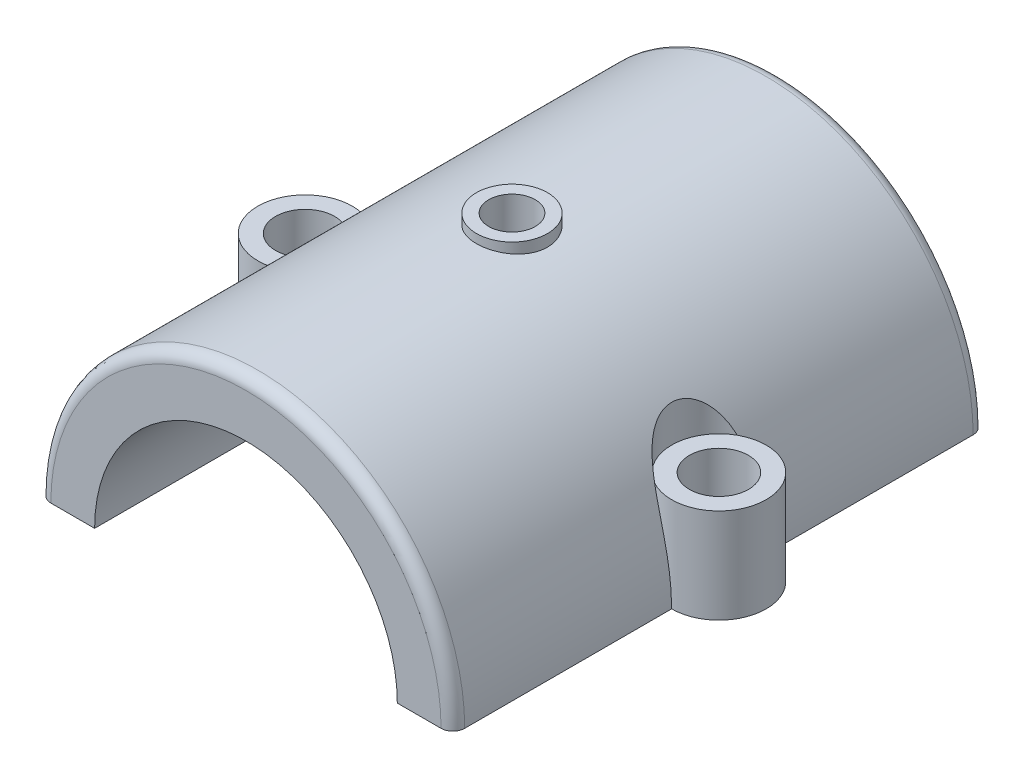
from build123d import *

# Parameters (mm, degrees)
BOSS_EXTRUDE1_DEPTH     = 114.3
SKETCH3_R               = 10.16
BOSS_EXTRUDE2_DEPTH     = 20.32
SKETCH5_R               = 10.16
CUT_EXTRUDE1_DEPTH      = 12.7
FILLET2_R               = 2.54
SKETCH6_R               = 6.35
CUT_EXTRUDE2_DEPTH      = 129.953476168
BOSS_EXTRUDE3_START     = 43.791955851
BOSS_EXTRUDE3_DEPTH     = 3.198044249
BOSS_EXTRUDE3_START_2   = 49
BOSS_EXTRUDE3_2_DEPTH   = 17
CUT_EXTRUDE3_DEPTH      = 136.11033375
CUT_EXTRUDE3_DEPTH_BACK = 136.11033375
SKETCH8_W               = 15.239999981
SKETCH8_H               = 4.021184516
CUT_EXTRUDE4_DEPTH      = 135.882901337
CUT_EXTRUDE4_DEPTH_BACK = 135.882901337
SKETCH10_R              = 3.175
SKETCH11_R              = 5
CUT_EXTRUDE5_DEPTH      = 30


with BuildPart() as part:
    # Sketch2 → Boss-Extrude1 (new body)
    with BuildSketch(Plane.XY):
        with BuildLine():
            Line((-44.45, 0), (-32.512, 0))
            ThreePointArc((-32.512, 0), (0, 32.512), (32.512, 0))
            Line((32.512, 0), (44.45, 0))
            ThreePointArc((44.45, 0), (0, 44.45), (-44.45, 0))
        make_face()
    extrude(amount=BOSS_EXTRUDE1_DEPTH)

    # Sketch3 → Boss-Extrude2 (add)
    with BuildSketch(Plane.XZ):
        with Locations((44.45, 57.15)):
            Circle(SKETCH3_R)
        with Locations((-44.45, 57.15)):
            Circle(SKETCH3_R)
    extrude(amount=-BOSS_EXTRUDE2_DEPTH)

    # Sketch5 → Cut-Extrude1 (cut)
    with BuildSketch(Plane(origin=(0, 20.32, 0), x_dir=(1, 0, 0), z_dir=(0, 1, 0))):
        with Locations((44.45, -57.15)):
            Circle(SKETCH5_R)
        with Locations((-44.45, -57.15)):
            Circle(SKETCH5_R)
    extrude(amount=CUT_EXTRUDE1_DEPTH, mode=Mode.SUBTRACT)

    # Fillet2
    fillet2_edges = [part.edges().sort_by_distance(p)[0] for p in [
        (0, 44.45, 114.3),
        (0, 44.45, 0),
    ]]
    fillet(fillet2_edges, radius=FILLET2_R)

    # Sketch6 → Cut-Extrude2 (cut, through all)
    with BuildSketch(Plane(origin=(0, 20.32, 0), x_dir=(1, 0, 0), z_dir=(0, 1, 0))):
        with Locations(Location((44.45, -57.15, 0), (0, 0, 270))):
            Circle(SKETCH6_R)
        with Locations(Location((-44.45, -57.15, 0), (0, 0, 270))):
            Circle(SKETCH6_R)
    extrude(amount=-CUT_EXTRUDE2_DEPTH, mode=Mode.SUBTRACT)

    # Boss-Extrude3: read off the stored shape, not the designer's step
    # Boss-Extrude3 outline → Boss-Extrude3 (add)
    with BuildSketch(Plane(origin=(0, 0, 0), x_dir=(1, 0, 0), z_dir=(0, 1, 0)).offset(BOSS_EXTRUDE3_START)):
        with BuildLine():
            add(Edge.make_bspline(
                [(0, -49.53), (-1.008821651, -49.53), (-1.998619935, -49.72927394), (-3.843308667, -50.494879009), (-4.687454894, -51.060962916), (-6.791679377, -53.165741576), (-7.618847434, -55.15374527), (-7.620574374, -58.141520807), (-7.42290115, -59.141073642), (-6.658087545, -60.988450986), (-6.098856032, -61.827039285), (-4.680577167, -63.2461413), (-3.842032005, -63.805727128), (-1.998902378, -64.570532515), (-0.998499986, -64.769608068), (1.988013472, -64.770782097), (3.977148932, -63.946590903), (6.086279789, -61.841304586), (6.651483441, -61.000012912), (7.419760337, -59.152994739), (7.619200893, -58.162953427), (7.620794336, -56.149105114), (7.421964798, -55.156604804), (6.658890114, -53.313547431), (6.092840739, -52.467609132), (3.99113944, -50.362690075), (2.017643301, -49.53), (0, -49.53)],
                knots=[0, 0, 0, 0, 0.0625, 0.0625, 0.125, 0.125, 0.25, 0.25, 0.3125, 0.3125, 0.375, 0.375, 0.4375, 0.4375, 0.5, 0.5, 0.625, 0.625, 0.6875, 0.6875, 0.75, 0.75, 0.8125, 0.8125, 0.875, 0.875, 1, 1, 1, 1], degree=3))
        make_face()
    extrude(amount=BOSS_EXTRUDE3_DEPTH)

    # Boss-Extrude3 2 outline → Boss-Extrude3 2 (cut)
    with BuildSketch(Plane.XY.offset(BOSS_EXTRUDE3_START_2)):
        with BuildLine():
            Line((-9, 46.09176164), (-7.623050959, 46.33145572))
            ThreePointArc((-7.623050959, 46.33145572), (-3.825721713, 46.825057902), (0, 46.99))
            Line((0, 46.99), (-9, 46.9900001))
            Line((-9, 46.9900001), (-9, 46.09176164))
        make_face()
        with BuildLine():
            Line((9, 46.9900001), (0, 46.99))
            ThreePointArc((0, 46.99), (3.825781455, 46.825052741), (7.623169112, 46.331435152))
            Line((7.623169112, 46.331435152), (9, 46.091757812))
            Line((9, 46.091757812), (9, 46.9900001))
        make_face()
    extrude(amount=BOSS_EXTRUDE3_2_DEPTH, mode=Mode.SUBTRACT)

    # Sketch8 → Cut-Extrude3 (cut, two sides: drawn at the far end of the back side and taken through both)
    with BuildSketch(Plane.XY.offset(114.3).offset(-CUT_EXTRUDE3_DEPTH_BACK)):
        with Locations((9e-09, 48.342600124)):
            Rectangle(SKETCH8_W, SKETCH8_H)
    extrude(amount=CUT_EXTRUDE3_DEPTH + CUT_EXTRUDE3_DEPTH_BACK, mode=Mode.SUBTRACT)

    # Sketch10 → Cut-Extrude4 (cut, two sides: drawn at the far end of the back side and taken through both)
    with BuildSketch(Plane(origin=(0, 46.332007866, 0), x_dir=(1, 0, 0), z_dir=(0, 1, 0)).offset(-CUT_EXTRUDE4_DEPTH_BACK)):
        with Locations(Location((0, -57.15, 0), (0, 0, 270))):
            Circle(SKETCH10_R)
    extrude(amount=CUT_EXTRUDE4_DEPTH + CUT_EXTRUDE4_DEPTH_BACK, mode=Mode.SUBTRACT)

    # Sketch11 → Cut-Extrude5 (cut)
    with BuildSketch(Plane(origin=(0, 46.332007866, 0), x_dir=(1, 0, 0), z_dir=(0, 1, 0))):
        with Locations(Location((0, -57.15, 0), (0, 0, 270))):
            Circle(SKETCH11_R)
    extrude(amount=-CUT_EXTRUDE5_DEPTH, mode=Mode.SUBTRACT)


solid = part.part
